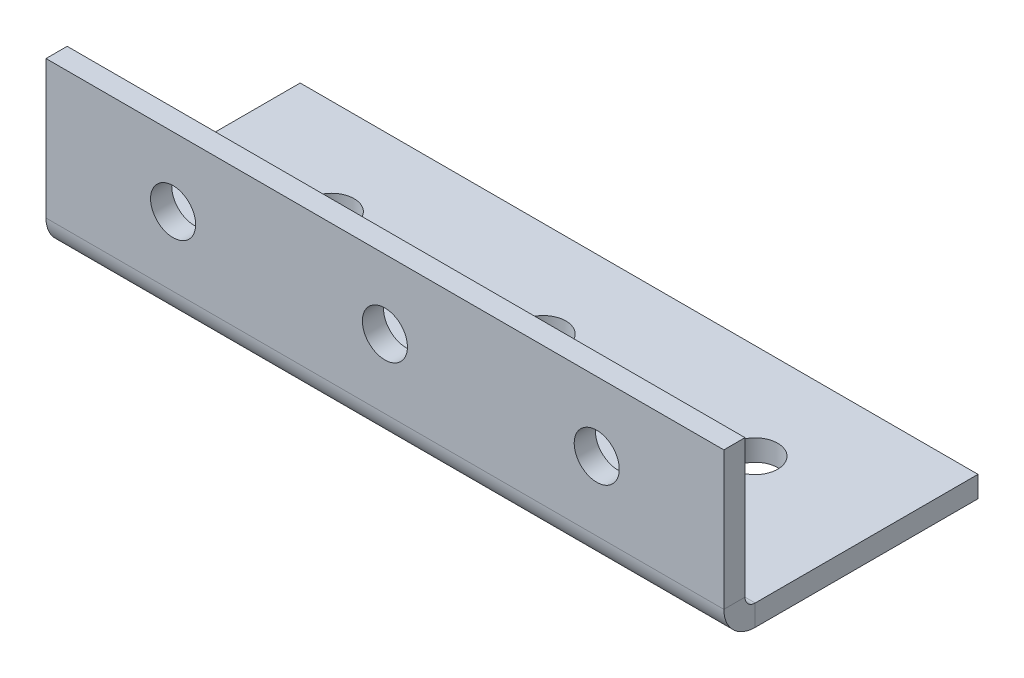
from build123d import *

# Parameters (mm, degrees)
SKETCH1_W                         = 101.6
SKETCH1_H                         = 38.1
BASE_FLANGE1_DEPTH                = 3.175
EDGE_FLANGE1_STRIP_W              = 15.748
EDGE_FLANGE1_STRIP_H              = 3.175
EDGE_FLANGE1_STRIP_CUT_DEPTH      = 101.6
EDGE_FLANGE1_DEPTH                = 101.6
F_1_4_CLEARANCE_HOLE1_D           = 6.7564
F_1_4_CLEARANCE_HOLE1_ON_FACE_2_D = 6.7564


# Sheet-metal steps are written as plain solids
with BuildPart() as part:
    # Sketch1 → Base-Flange1 (new body)
    with BuildSketch(Plane(origin=(0, 0, 0), x_dir=(1, 0, 0), z_dir=(0, 1, 0))):
        with Locations((50.8, 19.05)):
            Rectangle(SKETCH1_W, SKETCH1_H)
    extrude(amount=-BASE_FLANGE1_DEPTH)

    # Edge-Flange1 strip (across the edge) → Edge-Flange1 strip cut (cut)
    with BuildSketch(Plane(origin=(0, 0, 0), x_dir=(0, 0, -1), z_dir=(1, 0, 0))):
        with Locations((-3.175, -1.5875)):
            Rectangle(EDGE_FLANGE1_STRIP_W, EDGE_FLANGE1_STRIP_H)
    extrude(amount=EDGE_FLANGE1_STRIP_CUT_DEPTH, mode=Mode.SUBTRACT)

    # Edge-Flange1 section (across the edge) → Edge-Flange1 (add)
    with BuildSketch(Plane(origin=(0, 0, 0), x_dir=(0, 0, -1), z_dir=(1, 0, 0))):
        with BuildLine():
            Line((0, 1.524), (0, 22.225))
            Line((0, 22.225), (3.175, 22.225))
            Line((3.175, 22.225), (3.175, 1.524))
            ThreePointArc((3.175, 1.524), (3.621369265, 0.446369265), (4.699, 0))
            Line((4.699, 0), (4.699, -3.175))
            ThreePointArc((4.699, -3.175), (1.376305235, -1.798694765), (0, 1.524))
        make_face()
    extrude(amount=EDGE_FLANGE1_DEPTH)

    # 1/4 Clearance Hole1 (through all)
    with Locations(Plane(origin=(19.05, 0, -23.749), x_dir=(0, 0, 1), z_dir=(0, 1, 0))):
        with Locations((0, 0), (0, 31.75), (0, 63.5)):
            Hole(F_1_4_CLEARANCE_HOLE1_D / 2)

    # 1/4 Clearance Hole1 on face 2 (through all)
    with Locations(Plane(origin=(19.05, 11.8745, -3.175), x_dir=(-1, 0, 0), z_dir=(0, 0, -1))):
        with Locations((0, 0), (-31.75, 0), (-63.5, 0)):
            Hole(F_1_4_CLEARANCE_HOLE1_ON_FACE_2_D / 2)


solid = part.part
